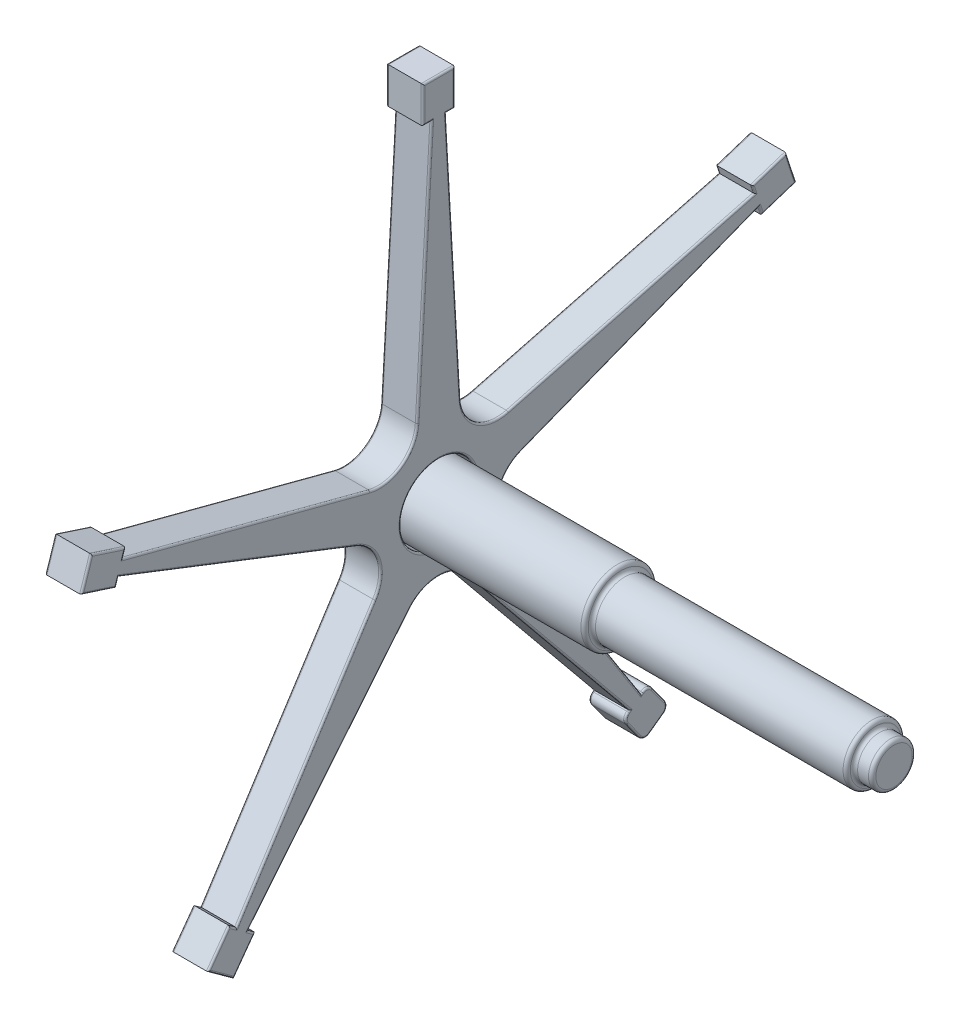
from build123d import *

# Parameters (mm, degrees)
SKETCH1_R           = 10.5
SKETCH1_R_2         = 2.7218001772914353
BOSS_EXTRUDE7_DEPTH = 5
SKETCH3_R           = 3.145000000000002
SKETCH3_R_2         = 3.1450000000018696
SKETCH3_R_3         = 3.145000000006957
SKETCH3_R_4         = 3.1450000000086242
SKETCH3_R_5         = 3.1450000000049365
CUT_EXTRUDE1_DEPTH  = 5
FILLET1_R           = 1
FILLET2_R           = 0.5
FILLET3_R           = 2


# Some blends are built 0.0001 mm under size
with BuildPart() as part:
    # Sketch1 → Boss-Extrude7 (new, symmetric)
    # profile 1 of 2: a face of its own
    with BuildSketch(Plane(origin=(0, 0, 0), x_dir=(0, 0, -1), z_dir=(1, 0, 0))):
        with BuildLine():
            Line((-7.9916982051777445, -21.207585031756107), (-52.372733843150705, -75.48763362883258))
            Line((-52.372733843150705, -75.48763362883258), (-50.44376242811065, -76.8891133971659))
            Line((-50.44376242811065, -76.8891133971659), (-56.30856576817534, -84.96132268154989))
            Line((-56.30856576817534, -84.96132268154989), (-63.402576575755184, -79.8072221357135))
            Line((-63.402576575755184, -79.8072221357135), (-57.53777323569049, -71.73501285132951))
            Line((-57.53777323569049, -71.73501285132951), (-55.608801820650456, -73.13649261966269))
            Line((-55.608801820650456, -73.13649261966269), (-17.69990213767711, -14.154162004246427))
            ThreePointArc((-17.69990213767711, -14.154162004246427), (-16.566190787250914, -5.382828086392932), (-22.639043256308522, 1.046951304350831))
            Line((-22.639043256308522, 1.046951304350831), (-87.9769314194695, 26.48236697577778))
            Line((-87.9769314194695, 26.48236697577778), (-88.71373293668783, 24.214725076069225))
            Line((-88.71373293668783, 24.214725076069225), (-98.20318407824645, 27.29803465840147))
            Line((-98.20318407824645, 27.29803465840147), (-95.49351306631003, 35.63754452299917))
            Line((-95.49351306631003, 35.63754452299917), (-86.00406192475141, 32.55423494066694))
            Line((-86.00406192475141, 32.55423494066694), (-86.74086344196972, 30.286593040958394))
            Line((-86.74086344196972, 30.286593040958394), (-18.930839323809206, 12.4596294998927))
            ThreePointArc((-18.930839323809206, 12.4596294998927), (-10.238468970636488, 14.091897176426205), (-6.000000000000013, 21.85443419144416))
            Line((-6.000000000000013, 21.85443419144416), (-1.9999999999999991, 91.85443419144417))
            Line((-1.9999999999999991, 91.85443419144417), (-4.384339795643448, 91.85443419144417))
            Line((-4.384339795643448, 91.85443419144417), (-4.384339795643448, 101.83223359554776))
            Line((-4.384339795643448, 101.83223359554776), (4.384339795643448, 101.83223359554776))
            Line((4.384339795643448, 101.83223359554776), (4.384339795643448, 91.85443419144417))
            Line((4.384339795643448, 91.85443419144417), (2.0000000000000004, 91.85443419144417))
            Line((2.0000000000000004, 91.85443419144417), (5.9999999999999885, 21.854434191444152))
            ThreePointArc((5.9999999999999885, 21.854434191444152), (10.238468970636458, 14.091897176426173), (18.930839323809195, 12.459629499892664))
            Line((18.930839323809195, 12.459629499892664), (86.74086344196972, 30.286593040958405))
            Line((86.74086344196972, 30.286593040958405), (86.00406192475147, 32.55423494066691))
            Line((86.00406192475147, 32.55423494066691), (95.4935130663101, 35.63754452299915))
            Line((95.4935130663101, 35.63754452299915), (98.20318407824652, 27.298034658401416))
            Line((98.20318407824652, 27.298034658401416), (88.7137329366879, 24.21472507606918))
            Line((88.7137329366879, 24.21472507606918), (87.97693141946955, 26.482366975777722))
            Line((87.97693141946955, 26.482366975777722), (22.639043256308604, 1.0469513043507936))
            ThreePointArc((22.639043256308604, 1.0469513043507936), (16.566190787251003, -5.382828086392962), (17.6999021376772, -14.154162004246446))
            Line((17.6999021376772, -14.154162004246446), (55.6088018206506, -73.1364926196627))
            Line((55.6088018206506, -73.1364926196627), (57.537773235690594, -71.73501285132951))
            Line((57.537773235690594, -71.73501285132951), (63.402576575755305, -79.80722213571354))
            Line((63.402576575755305, -79.80722213571354), (56.30856576817548, -84.96132268154999))
            Line((56.30856576817548, -84.96132268154999), (50.44376242811077, -76.88911339716593))
            Line((50.44376242811077, -76.88911339716593), (52.372733843150804, -75.4876336288326))
            Line((52.372733843150804, -75.4876336288326), (7.991698205177839, -21.207585031756107))
            ThreePointArc((7.991698205177839, -21.207585031756107), (4.747e-14, -17.41887022038138), (-7.9916982051777445, -21.207585031756107))
        make_face()
        Circle(SKETCH1_R, mode=Mode.SUBTRACT)
        with Locations((2.6e-15, 96.84333389349597)):
            Circle(SKETCH1_R_2, mode=Mode.SUBTRACT)
    # profile 2 of 2: a face of its own
    with BuildSketch(Plane(origin=(0, 0, 0), x_dir=(0, 0, -1), z_dir=(1, 0, 0))):
        with Locations((2.6e-15, 96.84333389349597)):
            Circle(SKETCH1_R_2)
    extrude(amount=BOSS_EXTRUDE7_DEPTH, both=True)

    # Sketch3 → Cut-Extrude1 (cut)
    with BuildSketch(Plane.ZY.offset(5)):
        with Locations((0, 96.93021991069479)):
            Circle(SKETCH3_R)
        with Locations((92.18611727199136, 29.953085220909514)):
            Circle(SKETCH3_R_2)
        with Locations((56.974153764980095, -78.41819517625055)):
            Circle(SKETCH3_R_3)
        with Locations((-56.97415376496519, -78.41819517625541)):
            Circle(SKETCH3_R_4)
        with Locations((-92.18611727198567, 29.953085220901652)):
            Circle(SKETCH3_R_5)
    extrude(amount=-CUT_EXTRUDE1_DEPTH, mode=Mode.SUBTRACT)

    # Fillet2
    fillet2_edges = [part.edges().sort_by_distance(p)[0] for p in [
        (5, 91.85443419144417, 3.1921698978217234),
        (5, 56.85443419144417, 4.000000000000006),
        (5, 14.091897176426205, 10.238468970636486),
        (5, 21.373111270425547, 52.835851382889466),
        (5, 31.420413990812666, 86.37246268336057),
        (-5, 96.93021991069479, -3.145000000000002),
        (5, 34.095889731833054, 90.74878749553072),
        (-5, 29.953085220909514, 89.04111727198949),
        (5, 31.46778959070032, 96.84834857227824),
        (-5, -78.41819517625055, 53.829153764973135),
        (5, 25.756379867235346, 93.45845850746714),
        (-5, -78.41819517625541, -60.11915376497381),
        (5, -17.41887022038138, -4.685e-14),
        (-5, 29.953085220901656, -95.3311172719906),
        (5, 25.348546025923504, 88.34533217807866),
        (5, 13.764659140064305, 55.307987337889),
        (5, -5.382828086392933, 16.566190787250914),
        (5, -43.64532731195456, 36.654351979163785),
        (5, -72.43575273549611, 56.57328752817047),
        (5, -75.7711174935215, 60.470174905722835),
        (5, -82.38427240863169, 59.855571171965266),
        (5, -80.9252180393579, 53.37616409814299),
        (5, -76.18837351299925, 51.40824813563068),
        (5, -48.347609330294354, -30.182216024164322),
        (5, -76.18837351299926, -51.408248135630785),
        (5, -80.92521803935796, -53.37616409814312),
        (5, -82.38427240863177, -59.855571171965394),
        (5, -75.77111749352153, -60.47017490572295),
        (5, -72.43575273549611, -56.573287528170596),
        (-5, -76.18837351299925, 51.40824813563068),
        (-5, -80.9252180393579, 53.37616409814299),
        (-5, -82.38427240863169, 59.855571171965266),
        (-5, -75.7711174935215, 60.470174905722835),
        (-5, -72.43575273549611, 56.57328752817047),
        (5, -43.645327311954574, -36.6543519791639),
        (-5, -43.64532731195456, 36.654351979163785),
        (-5, -5.382828086392933, 16.566190787250914),
        (-5, 13.764659140064305, 55.307987337889),
        (-5, 25.348546025923504, 88.34533217807866),
        (-5, 25.756379867235346, 93.45845850746714),
        (-5, 31.46778959070032, 96.84834857227824),
        (-5, 34.095889731833054, 90.74878749553072),
        (-5, 31.420413990812666, 86.37246268336057),
        (5, -5.382828086392961, -16.566190787251003),
        (-5, 21.373111270425547, 52.835851382889466),
        (-5, 14.091897176426205, 10.238468970636486),
        (-5, 56.85443419144417, 4.000000000000006),
        (-5, 91.85443419144417, 3.1921698978217234),
        (-5, 96.84333389349597, 4.384339795643448),
        (-5, 101.83223359554776, 0),
        (-5, 96.84333389349597, -4.384339795643448),
        (-5, 91.85443419144417, -3.1921698978217243),
        (5, 13.764659140064259, -55.307987337889074),
        (-5, 56.85443419144416, -3.9999999999999947),
        (-5, 14.091897176426173, -10.23846897063646),
        (5, 1.29e-15, 10.5),
        (-5, 21.373111270425536, -52.83585138288946),
        (-5, 31.420413990812655, -86.3724626833606),
        (-5, 34.095889731833026, -90.74878749553079),
        (-5, 31.467789590700285, -96.84834857227831),
        (-5, 25.756379867235296, -93.45845850746721),
        (-5, 25.34854602592345, -88.34533217807873),
        (5, 25.34854602592345, -88.34533217807873),
        (-5, 13.764659140064259, -55.307987337889074),
        (-5, -5.382828086392961, -16.566190787251003),
        (-5, -43.645327311954574, -36.6543519791639),
        (-5, -72.43575273549611, -56.573287528170596),
        (-5, -75.77111749352153, -60.47017490572295),
        (-5, -82.38427240863177, -59.855571171965394),
        (-5, -80.92521803935796, -53.37616409814312),
        (-5, -76.18837351299926, -51.408248135630785),
        (5, 25.756379867235296, -93.45845850746721),
        (-5, -48.347609330294354, -30.182216024164322),
        (-5, -17.41887022038138, -4.685e-14),
        (-5, -48.34760933029435, 30.182216024164223),
        (-5, 1.29e-15, 10.5),
        (5, 31.467789590700285, -96.84834857227831),
        (5, 34.095889731833026, -90.74878749553079),
        (5, 31.420413990812655, -86.3724626833606),
        (5, 21.373111270425536, -52.83585138288946),
        (5, 14.091897176426173, -10.23846897063646),
        (5, 56.85443419144416, -3.9999999999999947),
        (5, 91.85443419144417, -3.1921698978217243),
        (5, 96.84333389349597, -4.384339795643448),
        (5, -48.34760933029435, 30.182216024164223),
        (5, 101.83223359554776, 0),
        (5, 96.84333389349597, 4.384339795643448),
    ]]
    fillet(fillet2_edges, radius=FILLET2_R)

    # Fillet3
    # the kernel refuses this fillet: 2 mm, written as the material it takes off along each edge
    with BuildSketch(Plane(origin=(-5, -74.52861734466433, -57.095309751525626), x_dir=(0, 0.8090169943749571, 0.5877852522924601), z_dir=(0, -0.5877852522924601, 0.8090169943749571))) as fillet3_piece_1:
        with BuildLine():
            CenterArc((1.5, -0.5), 0.5, 0, 90)
            Line((2, -0.5), (2, 0))
            Line((2, 0), (1.5, 0))
        make_face()
    revolve(axis=Axis((-5, -74.52861734466433, -57.095309751525626), (-1, 0, 0)), revolution_arc=89.9999999999991, mode=Mode.SUBTRACT)
    with BuildSketch(Plane(origin=(-5, -79.36475865154861, -60.608972082420465), x_dir=(0, 0.5877852522924726, -0.8090169943749478), z_dir=(0, 0.8090169943749478, 0.5877852522924726))) as fillet3_piece_2:
        with BuildLine():
            CenterArc((1.5, -0.5), 0.5, 0, 90)
            Line((2, -0.5), (2, 0))
            Line((2, 0), (1.5, 0))
        make_face()
    revolve(axis=Axis((-5, -79.36475865154861, -60.608972082420465), (-1, 0, 0)), revolution_arc=89.99999999999973, mode=Mode.SUBTRACT)
    with BuildSketch(Plane(origin=(-5, -82.16771818821513, -56.751029252340416), x_dir=(0, -0.8090169943749451, -0.5877852522924764), z_dir=(0, 0.5877852522924764, -0.8090169943749451))) as fillet3_piece_3:
        with BuildLine():
            CenterArc((1.5, -0.5), 0.5, 0, 90)
            Line((2, -0.5), (2, 0))
            Line((2, 0), (1.5, 0))
        make_face()
    revolve(axis=Axis((-5, -82.16771818821513, -56.751029252340416), (-1, 0, 0)), revolution_arc=90.0000000000004, mode=Mode.SUBTRACT)
    with BuildSketch(Plane(origin=(-5, -77.33157688133085, -53.23736692144558), x_dir=(0, -0.5877852522924708, 0.8090169943749491), z_dir=(0, -0.8090169943749491, -0.5877852522924708))) as fillet3_piece_4:
        with BuildLine():
            CenterArc((1.5, -0.5), 0.5, 0, 90)
            Line((2, -0.5), (2, 0))
            Line((2, 0), (1.5, 0))
        make_face()
    revolve(axis=Axis((-5, -77.33157688133085, -53.23736692144558), (-1, 0, 0)), revolution_arc=89.9999999999985, mode=Mode.SUBTRACT)
    with BuildSketch(Plane(origin=(5, -74.52861734466433, -57.095309751525626), x_dir=(0, 0.5877852522924726, -0.8090169943749478), z_dir=(0, -0.8090169943749478, -0.5877852522924726))) as fillet3_piece_5:
        with BuildLine():
            CenterArc((1.5, -0.5), 0.5, 0, 90)
            Line((2, -0.5), (2, 0))
            Line((2, 0), (1.5, 0))
        make_face()
    revolve(axis=Axis((5, -74.52861734466433, -57.095309751525626), (1, 0, 0)), revolution_arc=89.9999999999991, mode=Mode.SUBTRACT)
    with BuildSketch(Plane(origin=(5, -79.36475865154861, -60.608972082420465), x_dir=(0, -0.8090169943749451, -0.5877852522924764), z_dir=(0, -0.5877852522924764, 0.8090169943749451))) as fillet3_piece_6:
        with BuildLine():
            CenterArc((1.5, -0.5), 0.5, 0, 90)
            Line((2, -0.5), (2, 0))
            Line((2, 0), (1.5, 0))
        make_face()
    revolve(axis=Axis((5, -79.36475865154861, -60.608972082420465), (1, 0, 0)), revolution_arc=89.99999999999973, mode=Mode.SUBTRACT)
    with BuildSketch(Plane(origin=(5, -82.16771818821513, -56.751029252340416), x_dir=(0, -0.5877852522924708, 0.8090169943749491), z_dir=(0, 0.8090169943749491, 0.5877852522924708))) as fillet3_piece_7:
        with BuildLine():
            CenterArc((1.5, -0.5), 0.5, 0, 90)
            Line((2, -0.5), (2, 0))
            Line((2, 0), (1.5, 0))
        make_face()
    revolve(axis=Axis((5, -82.16771818821513, -56.751029252340416), (1, 0, 0)), revolution_arc=90.0000000000004, mode=Mode.SUBTRACT)
    with BuildSketch(Plane(origin=(5, -77.33157688133085, -53.23736692144558), x_dir=(0, 0.8090169943749338, 0.587785252292492), z_dir=(0, 0.587785252292492, -0.8090169943749338))) as fillet3_piece_8:
        with BuildLine():
            CenterArc((1.5, -0.5), 0.5, 0, 90)
            Line((2, -0.5), (2, 0))
            Line((2, 0), (1.5, 0))
        make_face()
    revolve(axis=Axis((5, -77.33157688133085, -53.23736692144558), (1, 0, 0)), revolution_arc=89.9999999999985, mode=Mode.SUBTRACT)
    with BuildSketch(Plane(origin=(-5, -76.88911339716593, -50.44376242811077), x_dir=(0, 0.5877852522924929, -0.809016994374933), z_dir=(1, 0, 0))) as fillet3_piece_9:
        with BuildLine():
            CenterArc((FILLET3_R, -FILLET3_R), FILLET3_R, 89.99999999999982, 89.99999999999854)
            Line((-6.112e-14, -FILLET3_R), (0, 0))
            Line((0, 0), (FILLET3_R, -2e-17))
        make_face()
    extrude(amount=10, mode=Mode.SUBTRACT)
    with BuildSketch(Plane(origin=(5, -84.96132268154999, -56.30856576817548), x_dir=(0, 0.8090169943749473, 0.5877852522924732), z_dir=(-1, 0, 0))) as fillet3_piece_10:
        with BuildLine():
            CenterArc((FILLET3_R, FILLET3_R), FILLET3_R, 179.9999999999997, 90.00000000000057)
            Line((1.832e-14, FILLET3_R), (0, 0))
            Line((0, 0), (FILLET3_R, -4e-17))
        make_face()
    extrude(amount=10, mode=Mode.SUBTRACT)
    with BuildSketch(Plane(origin=(5, -79.80722213571354, -63.402576575755305), x_dir=(0, -0.5877852522924777, 0.8090169943749441), z_dir=(-1, 0, 0))) as fillet3_piece_11:
        with BuildLine():
            CenterArc((FILLET3_R, FILLET3_R), FILLET3_R, 180.0000000000001, 89.99999999999989)
            Line((-5.69e-15, FILLET3_R), (0, 0))
            Line((0, 0), (FILLET3_R, -1e-16))
        make_face()
    extrude(amount=10, mode=Mode.SUBTRACT)
    with BuildSketch(Plane(origin=(5, -71.73501285132951, -57.537773235690594), x_dir=(0, -0.8090169943749468, -0.5877852522924741), z_dir=(-1, 0, 0))) as fillet3_piece_12:
        with BuildLine():
            CenterArc((FILLET3_R, FILLET3_R), FILLET3_R, 180.00000000000105, 89.99999999999926)
            Line((-3.701e-14, FILLET3_R), (0, 0))
            Line((0, 0), (FILLET3_R, -4e-17))
        make_face()
    extrude(amount=10, mode=Mode.SUBTRACT)


with BuildPart() as body_2:
    # Sketch4 → Revolve1 (revolve)
    with BuildSketch(Plane(origin=(0, 0, 0), x_dir=(1, 0, 0), z_dir=(0, 1, 0)), mode=Mode.PRIVATE) as revolve1_sk:
        Polygon((0, 0), (0, 9.999999999999998), (54.99999999999999, 9.99999999999999), (54.99999999999999, 7.999999999999989), (125, 7.999999999999998), (125, 5.999999999999998), (130, 6), (130, 0), align=None)
    revolve(revolve1_sk.sketch.rotate(Axis((0, 0, 0), (1, 0, 0)), 180), axis=Axis((0, 0, 0), (1, 0, 0)))

    # Fillet1
    fillet1_edges = [body_2.edges().sort_by_distance(p)[0] for p in [
        (54.99999999999999, -2.45e-15, -9.99999999999999),
        (54.99999999999999, -1.96e-15, -7.999999999999989),
        (125, -1.96e-15, -7.999999999999998),
        (125, -1.47e-15, -5.999999999999998),
        (130, -1.47e-15, -6),
    ]]
    fillet(fillet1_edges, radius=FILLET1_R - 0.0001)  # a hair under: the kernel refuses the full size


solid = Compound([part.part, body_2.part])
